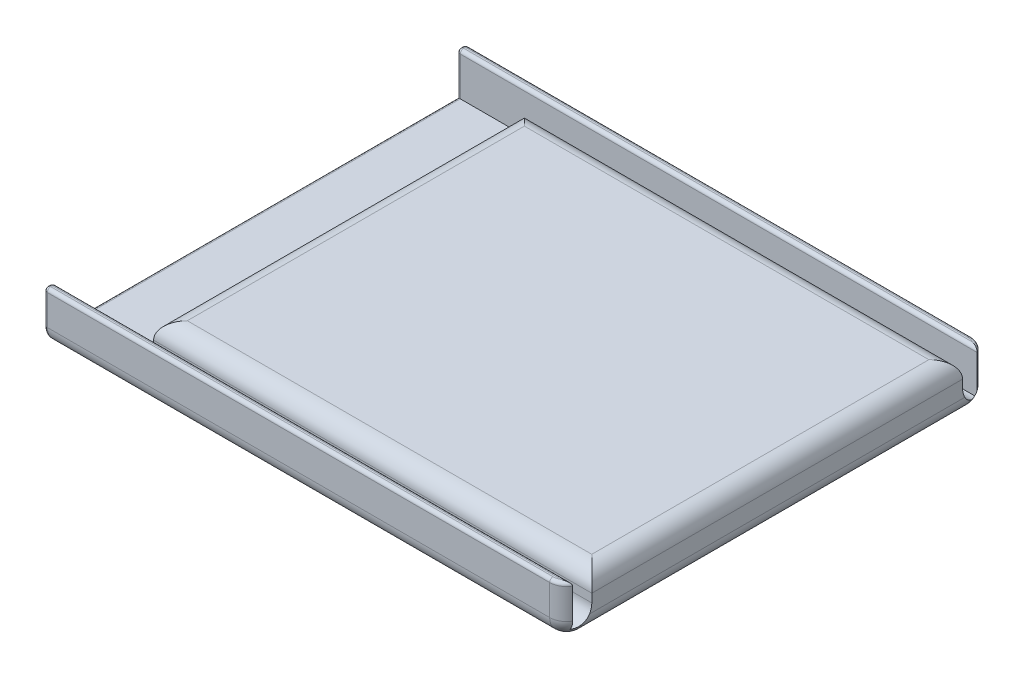
from build123d import *

# Parameters (mm, degrees)
SKETCH_2_W          = 31
SKETCH_2_H          = 25
EXTRUDE_1_DEPTH     = 3
SKETCH_3_W          = 31
SKETCH_3_H          = 1
CUT_EXTRUDE_1_DEPTH = 2.5
SKETCH_4_W          = 5
SKETCH_4_H          = 22
CUT_EXTRUDE_2_DEPTH = 2.5
FILLET_11_R         = 1
FILLET_12_R         = 1
FILLET_13_R         = 1
FILLET_18_R         = 1
FILLET_19_R         = 1
FILLET_20_R         = 1
FILLET_21_R         = 1
FILLET_22_R         = 0.2
FILLET_23_R         = 0.2
FILLET_24_R         = 0.2


# Some blends are built 0.0001 mm under size
with BuildPart() as part:
    # 草图2 → 凸台-拉伸1 (new body)
    with BuildSketch(Plane(origin=(0, 0, 0), x_dir=(1, 0, 0), z_dir=(0, 1, 0))):
        Rectangle(SKETCH_2_W, SKETCH_2_H)
    extrude(amount=EXTRUDE_1_DEPTH)

    # 草图3 → 切除-拉伸1 (cut)
    with BuildSketch(Plane(origin=(0, 3, 0), x_dir=(1, 0, 0), z_dir=(0, 1, 0))):
        with Locations((0, 11.5)):
            Rectangle(SKETCH_3_W, SKETCH_3_H)
        with Locations((0, -11.5)):
            Rectangle(SKETCH_3_W, SKETCH_3_H)
    extrude(amount=-CUT_EXTRUDE_1_DEPTH, mode=Mode.SUBTRACT)

    # 草图4 → 切除-拉伸2 (cut)
    with BuildSketch(Plane(origin=(0, 3, 0), x_dir=(1, 0, 0), z_dir=(0, 1, 0))):
        with Locations((-13, 0)):
            Rectangle(SKETCH_4_W, SKETCH_4_H)
    extrude(amount=-CUT_EXTRUDE_2_DEPTH, mode=Mode.SUBTRACT)

    # 圆角11
    fillet_11_edges = [part.edges().sort_by_distance(p)[0] for p in [
        (0, 0, 12.5),
    ]]
    fillet(fillet_11_edges, radius=FILLET_11_R)

    # 圆角12
    fillet_12_edges = [part.edges().sort_by_distance(p)[0] for p in [
        (0, 0, -12.5),
    ]]
    fillet(fillet_12_edges, radius=FILLET_12_R)

    # 圆角13
    # the kernel refuses this fillet: 1 mm, written as the material it takes off along each edge
    with BuildSketch(Plane(origin=(15.5, 1, 12.5), x_dir=(0, 0, -1), z_dir=(0, 1, 0))) as fillet_13_piece_1:
        with BuildLine():
            CenterArc((FILLET_13_R, FILLET_13_R), FILLET_13_R, 180, 90)
            Line((0, FILLET_13_R), (0, 0))
            Line((0, 0), (FILLET_13_R, 0))
        make_face()
    extrude(amount=4.5, mode=Mode.SUBTRACT)
    with BuildSketch(Plane(origin=(15.5, 1, -12.5), x_dir=(0, 0, 1), z_dir=(0, 1, 0))) as fillet_13_piece_2:
        with BuildLine():
            CenterArc((FILLET_13_R, -FILLET_13_R), FILLET_13_R, 90, 90)
            Line((0, -FILLET_13_R), (0, 0))
            Line((0, 0), (FILLET_13_R, 0))
        make_face()
    extrude(amount=4.5, mode=Mode.SUBTRACT)
    with BuildSketch(Plane(origin=(15.5, 0, -11.5), x_dir=(0, 1, 0), z_dir=(0, 0, 1))) as fillet_13_piece_3:
        with BuildLine():
            CenterArc((FILLET_13_R, FILLET_13_R), FILLET_13_R, 180, 90)
            Line((0, FILLET_13_R), (0, 0))
            Line((0, 0), (FILLET_13_R, 0))
        make_face()
    extrude(amount=23, mode=Mode.SUBTRACT)
    with BuildSketch(Plane(origin=(15.5, 1, -11.5), x_dir=(0, -1, 0), z_dir=(0, 0, 1))) as fillet_13_piece_4:
        with BuildLine():
            CenterArc((1 - FILLET_13_R, -FILLET_13_R), FILLET_13_R, 0, 90)
            Line((1, -FILLET_13_R), (1, 0))
            Line((1, 0), (1 - FILLET_13_R, 0))
        make_face()
    revolve(axis=Axis((15.5, 1, -11.5), (1, 0, 0)), revolution_arc=90, mode=Mode.SUBTRACT)
    with BuildSketch(Plane(origin=(15.5, 1, 11.5), x_dir=(0, 0, 1), z_dir=(0, 1, 0))) as fillet_13_piece_5:
        with BuildLine():
            CenterArc((1 - FILLET_13_R, -FILLET_13_R), FILLET_13_R, 0, 90)
            Line((1, -FILLET_13_R), (1, 0))
            Line((1, 0), (1 - FILLET_13_R, 0))
        make_face()
    revolve(axis=Axis((15.5, 1, 11.5), (1, 0, 0)), revolution_arc=90, mode=Mode.SUBTRACT)

    # 圆角18
    fillet_18_edges = [part.edges().sort_by_distance(p)[0] for p in [
        (15.5, 3, 0),
        (2.5, 3, 11),
        (2.5, 3, -11),
        (-10.5, 3, 0),
    ]]
    fillet(fillet_18_edges, radius=FILLET_18_R)

    # 圆角19
    fillet_19_edges = [part.edges().sort_by_distance(p)[0] for p in [
        (-10.5, 0.5, 0),
    ]]
    fillet(fillet_19_edges, radius=FILLET_19_R)

    # 圆角20
    fillet_20_edges = [part.edges().sort_by_distance(p)[0] for p in [
        (1.933012702, 0.5, -11),
    ]]
    fillet(fillet_20_edges, radius=FILLET_20_R - 0.0001)  # a hair under: the kernel refuses the full size

    # 圆角21
    fillet_21_edges = [part.edges().sort_by_distance(p)[0] for p in [
        (1.933012702, 0.5, 11),
    ]]
    fillet(fillet_21_edges, radius=FILLET_21_R - 0.0001)  # a hair under: the kernel refuses the full size

    # 圆角22
    fillet_22_edges = [part.edges().sort_by_distance(p)[0] for p in [
        (-15.5, 3, 12.25),
        (-0.5, 3, 12.5),
        (-0.066987298, 3, 12),
        (15, 3, 12.366025404),
    ]]
    fillet(fillet_22_edges, radius=FILLET_22_R)

    # 圆角23
    fillet_23_edges = [part.edges().sort_by_distance(p)[0] for p in [
        (-15.5, 3, -12.25),
        (-0.5, 3, -12.5),
        (-0.066987298, 3, -12),
        (15, 3, -12.366025404),
    ]]
    fillet(fillet_23_edges, radius=FILLET_23_R)

    # 圆角24
    # the kernel refuses this fillet: 0.2 mm, written as the material it takes off along each edge
    with BuildSketch(Plane(origin=(-15.3, 2.8, 12.2), x_dir=(0, 0, -1), z_dir=(-1, 0, 0))) as fillet_24_piece_1_section:
        Polygon((0, 0), (FILLET_24_R, 0), (FILLET_24_R, -FILLET_24_R), (0, -FILLET_24_R), align=None)
    fillet_24_piece_1 = extrude(amount=FILLET_24_R, mode=Mode.PRIVATE)
    fillet_24_piece_1 = fillet_24_piece_1 - Plane(origin=(-15.3, 2.8, 12.2), x_dir=(0, -0.7071067811865475, 0.7071067811865475), z_dir=(-1, 0, 0)) * Sphere(FILLET_24_R, mode=Mode.PRIVATE)
    add(fillet_24_piece_1, mode=Mode.SUBTRACT)
    with BuildSketch(Plane(origin=(-15.3, 2.8, 12.3), x_dir=(0, 0, 1), z_dir=(-1, 0, 0))) as fillet_24_piece_2_section:
        Polygon((0, 0), (FILLET_24_R, 0), (FILLET_24_R, FILLET_24_R), (0, FILLET_24_R), align=None)
    fillet_24_piece_2 = extrude(amount=FILLET_24_R, mode=Mode.PRIVATE)
    fillet_24_piece_2 = fillet_24_piece_2 - Plane(origin=(-15.3, 2.8, 12.3), x_dir=(0, -0.7071067811865475, -0.7071067811865475), z_dir=(-1, 0, 0)) * Sphere(FILLET_24_R, mode=Mode.PRIVATE)
    add(fillet_24_piece_2, mode=Mode.SUBTRACT)
    with BuildSketch(Plane(origin=(-15.3, 2.8, -12.3), x_dir=(0, 0, -1), z_dir=(-1, 0, 0))) as fillet_24_piece_3_section:
        Polygon((0, 0), (FILLET_24_R, 0), (FILLET_24_R, -FILLET_24_R), (0, -FILLET_24_R), align=None)
    fillet_24_piece_3 = extrude(amount=FILLET_24_R, mode=Mode.PRIVATE)
    fillet_24_piece_3 = fillet_24_piece_3 - Plane(origin=(-15.3, 2.8, -12.3), x_dir=(0, -0.7071067811865475, 0.7071067811865475), z_dir=(-1, 0, 0)) * Sphere(FILLET_24_R, mode=Mode.PRIVATE)
    add(fillet_24_piece_3, mode=Mode.SUBTRACT)
    with BuildSketch(Plane(origin=(-15.3, 2.8, -12.2), x_dir=(0, 0, 1), z_dir=(-1, 0, 0))) as fillet_24_piece_4_section:
        Polygon((0, 0), (FILLET_24_R, 0), (FILLET_24_R, FILLET_24_R), (0, FILLET_24_R), align=None)
    fillet_24_piece_4 = extrude(amount=FILLET_24_R, mode=Mode.PRIVATE)
    fillet_24_piece_4 = fillet_24_piece_4 - Plane(origin=(-15.3, 2.8, -12.2), x_dir=(0, -0.7071067811865475, -0.7071067811865475), z_dir=(-1, 0, 0)) * Sphere(FILLET_24_R, mode=Mode.PRIVATE)
    add(fillet_24_piece_4, mode=Mode.SUBTRACT)
    with BuildSketch(Plane(origin=(-15.5, 1, 12.5), x_dir=(0, 0, -1), z_dir=(0, 1, 0))) as fillet_24_piece_5:
        with BuildLine():
            CenterArc((FILLET_24_R, -FILLET_24_R), FILLET_24_R, 90, 90)
            Line((0, -FILLET_24_R), (0, 0))
            Line((0, 0), (FILLET_24_R, 0))
        make_face()
    extrude(amount=1.8, mode=Mode.SUBTRACT)
    with BuildSketch(Plane(origin=(-15.5, 1, -12.5), x_dir=(0, 0, 1), z_dir=(0, 1, 0))) as fillet_24_piece_6:
        with BuildLine():
            CenterArc((FILLET_24_R, FILLET_24_R), FILLET_24_R, 180, 90)
            Line((0, FILLET_24_R), (0, 0))
            Line((0, 0), (FILLET_24_R, 0))
        make_face()
    extrude(amount=1.8, mode=Mode.SUBTRACT)
    with BuildSketch(Plane(origin=(-15.5, 0.5, 12), x_dir=(0, -1, 0), z_dir=(0, 0, -1))) as fillet_24_piece_7:
        with BuildLine():
            CenterArc((FILLET_24_R, -FILLET_24_R), FILLET_24_R, 90, 90)
            Line((0, -FILLET_24_R), (0, 0))
            Line((0, 0), (FILLET_24_R, 0))
        make_face()
    extrude(amount=24, mode=Mode.SUBTRACT)
    with BuildSketch(Plane(origin=(-15.5, 2.8, -12), x_dir=(0, 0, -1), z_dir=(0, -1, 0))) as fillet_24_piece_8:
        with BuildLine():
            CenterArc((FILLET_24_R, FILLET_24_R), FILLET_24_R, 180, 90)
            Line((0, FILLET_24_R), (0, 0))
            Line((0, 0), (FILLET_24_R, 0))
        make_face()
    extrude(amount=2.3, mode=Mode.SUBTRACT)
    with BuildSketch(Plane(origin=(-15.5, 2.8, 12), x_dir=(0, 0, 1), z_dir=(0, -1, 0))) as fillet_24_piece_9:
        with BuildLine():
            CenterArc((FILLET_24_R, -FILLET_24_R), FILLET_24_R, 90, 90)
            Line((0, -FILLET_24_R), (0, 0))
            Line((0, 0), (FILLET_24_R, 0))
        make_face()
    extrude(amount=2.3, mode=Mode.SUBTRACT)
    with BuildSketch(Plane(origin=(-15.5, 1, 11.5), x_dir=(0, 0, 1), z_dir=(0, 1, 0))) as fillet_24_piece_10:
        with BuildLine():
            CenterArc((1 - FILLET_24_R, FILLET_24_R), FILLET_24_R, 270, 90)
            Line((1, FILLET_24_R), (1, 0))
            Line((1, 0), (1 - FILLET_24_R, 0))
        make_face()
    revolve(axis=Axis((-15.5, 1, 11.5), (1, 0, 0)), revolution_arc=90, mode=Mode.SUBTRACT)
    with BuildSketch(Plane(origin=(-15.5, 0, 11.5), x_dir=(0, 1, 0), z_dir=(0, 0, -1))) as fillet_24_piece_11:
        with BuildLine():
            CenterArc((FILLET_24_R, FILLET_24_R), FILLET_24_R, 180, 90)
            Line((0, FILLET_24_R), (0, 0))
            Line((0, 0), (FILLET_24_R, 0))
        make_face()
    extrude(amount=23, mode=Mode.SUBTRACT)
    with BuildSketch(Plane(origin=(-15.5, 1, -11.5), x_dir=(0, -1, 0), z_dir=(0, 0, 1))) as fillet_24_piece_12:
        with BuildLine():
            CenterArc((1 - FILLET_24_R, FILLET_24_R), FILLET_24_R, 270, 90)
            Line((1, FILLET_24_R), (1, 0))
            Line((1, 0), (1 - FILLET_24_R, 0))
        make_face()
    revolve(axis=Axis((-15.5, 1, -11.5), (1, 0, 0)), revolution_arc=90, mode=Mode.SUBTRACT)
    with BuildSketch(Plane(origin=(-15.5, 0.5, 12.5), x_dir=(0, -1, 0), z_dir=(0, 0, -1))) as fillet_24_piece_13a_section:
        with BuildLine():
            CenterArc((FILLET_24_R, -FILLET_24_R), FILLET_24_R, 90, 90)
            Line((0, -FILLET_24_R), (0, 0))
            Line((0, 0), (FILLET_24_R, 0))
        make_face()
    fillet_24_piece_13a = extrude(amount=24.5, mode=Mode.PRIVATE)
    fillet_24_piece_13a = split(fillet_24_piece_13a, bisect_by=Plane(origin=(-15.454720977, 0.454720977, 12), z_dir=(0, 0, 1)), keep=Keep.TOP, mode=Mode.PRIVATE)
    with BuildSketch(Plane(origin=(-15.5, 2.8, 12), x_dir=(0, 0, 1), z_dir=(0, -1, 0))) as fillet_24_piece_13b_section:
        with BuildLine():
            CenterArc((FILLET_24_R, -FILLET_24_R), FILLET_24_R, 90, 90)
            Line((0, -FILLET_24_R), (0, 0))
            Line((0, 0), (FILLET_24_R, 0))
        make_face()
    fillet_24_piece_13b = extrude(amount=2.8, mode=Mode.PRIVATE)
    fillet_24_piece_13b = split(fillet_24_piece_13b, bisect_by=Plane(origin=(-15.454720977, 0.5, 12.045279023), z_dir=(0, -1, 0)), keep=Keep.TOP, mode=Mode.PRIVATE)
    fillet_24_piece_13 = fillet_24_piece_13a & fillet_24_piece_13b
    add(fillet_24_piece_13, mode=Mode.SUBTRACT)
    with BuildSketch(Plane(origin=(-15.5, 2.8, -12), x_dir=(0, 0, -1), z_dir=(0, -1, 0))) as fillet_24_piece_14a_section:
        with BuildLine():
            CenterArc((FILLET_24_R, FILLET_24_R), FILLET_24_R, 180, 90)
            Line((0, FILLET_24_R), (0, 0))
            Line((0, 0), (FILLET_24_R, 0))
        make_face()
    fillet_24_piece_14a = extrude(amount=2.8, mode=Mode.PRIVATE)
    fillet_24_piece_14a = split(fillet_24_piece_14a, bisect_by=Plane(origin=(-15.454720977, 0.5, -12.045279023), z_dir=(0, -1, 0)), keep=Keep.TOP, mode=Mode.PRIVATE)
    with BuildSketch(Plane(origin=(-15.5, 0.5, 12), x_dir=(0, -1, 0), z_dir=(0, 0, -1))) as fillet_24_piece_14b_section:
        with BuildLine():
            CenterArc((FILLET_24_R, -FILLET_24_R), FILLET_24_R, 90, 90)
            Line((0, -FILLET_24_R), (0, 0))
            Line((0, 0), (FILLET_24_R, 0))
        make_face()
    fillet_24_piece_14b = extrude(amount=24.5, mode=Mode.PRIVATE)
    fillet_24_piece_14b = split(fillet_24_piece_14b, bisect_by=Plane(origin=(-15.454720977, 0.454720977, -12), z_dir=(0, 0, -1)), keep=Keep.TOP, mode=Mode.PRIVATE)
    fillet_24_piece_14 = fillet_24_piece_14a & fillet_24_piece_14b
    add(fillet_24_piece_14, mode=Mode.SUBTRACT)


solid = part.part
